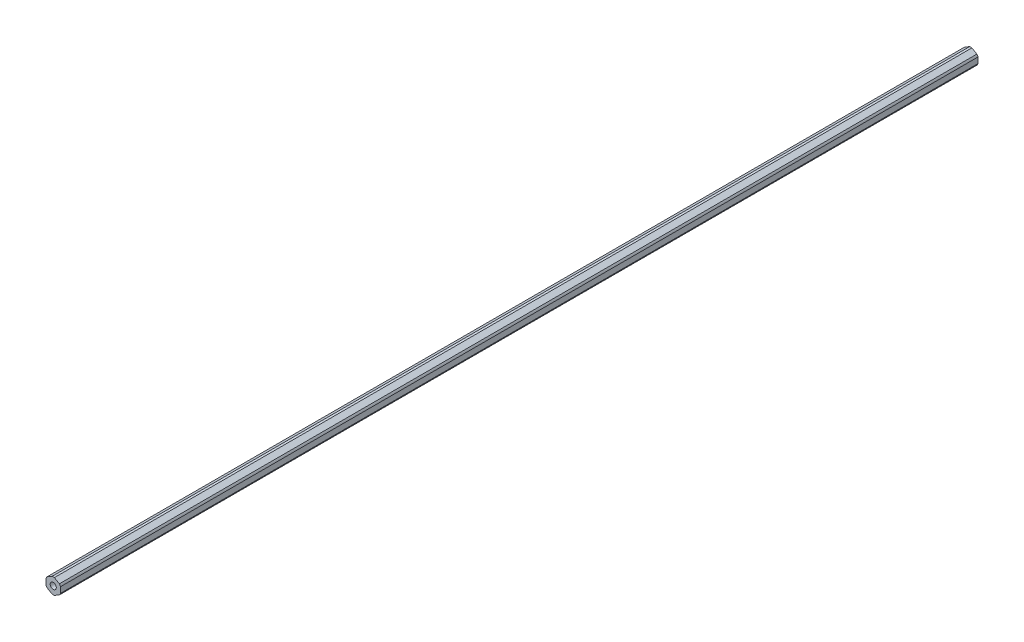
from build123d import *

# Parameters (mm, degrees)
SKETCH2_R           = 2.0193
BOSS_EXTRUDE1_DEPTH = 302.18126


with BuildPart() as part:
    # Sketch2 → Boss-Extrude1 (new, symmetric)
    with BuildSketch(Plane.XY):
        with BuildLine():
            ThreePointArc((0.741687758, 5.071047688), (0, 5.125000037), (-0.741687758, 5.071047688))
            Line((-0.741687758, 5.071047688), (-4.020812242, 3.177844283))
            ThreePointArc((-4.020812242, 3.177844283), (-4.438380226, 2.562500019), (-4.7625, 1.893203404))
            Line((-4.7625, 1.893203404), (-4.7625, -1.893203404))
            ThreePointArc((-4.7625, -1.893203404), (-4.438380226, -2.562500019), (-4.020812242, -3.177844283))
            Line((-4.020812242, -3.177844283), (-0.741687758, -5.071047688))
            ThreePointArc((-0.741687758, -5.071047688), (0, -5.125000037), (0.741687758, -5.071047688))
            Line((0.741687758, -5.071047688), (4.020812242, -3.177844283))
            ThreePointArc((4.020812242, -3.177844283), (4.438380226, -2.562500019), (4.7625, -1.893203404))
            Line((4.7625, -1.893203404), (4.7625, 1.893203404))
            ThreePointArc((4.7625, 1.893203404), (4.438380226, 2.562500019), (4.020812242, 3.177844283))
            Line((4.020812242, 3.177844283), (0.741687758, 5.071047688))
        make_face()
        Circle(SKETCH2_R, mode=Mode.SUBTRACT)
    extrude(amount=BOSS_EXTRUDE1_DEPTH, both=True)


solid = part.part
